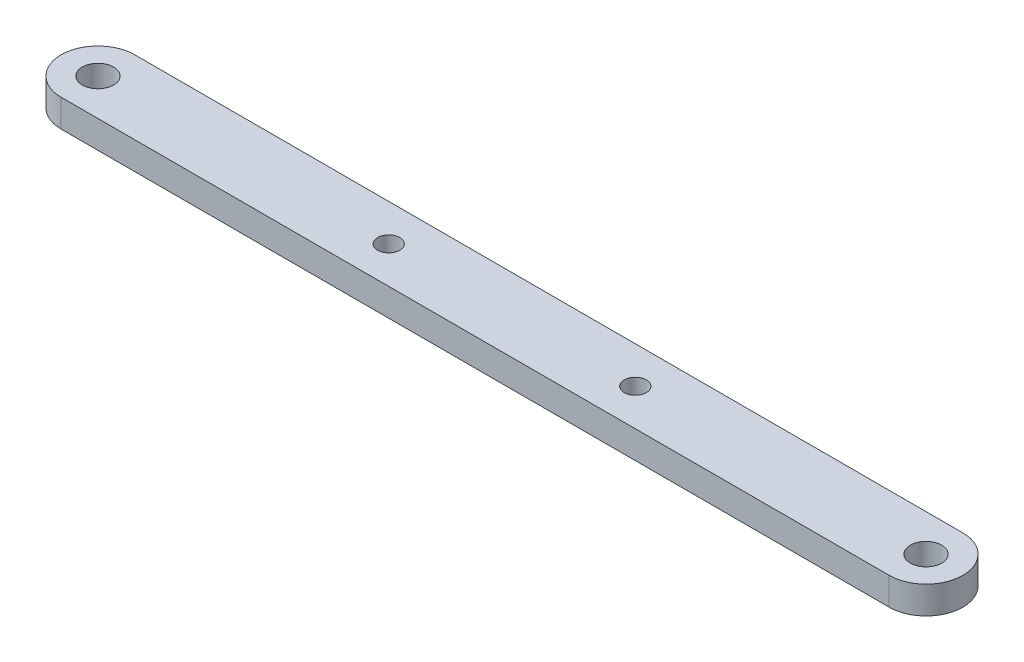
from build123d import *

# Parameters (mm, degrees)
BOSS_EXTRUDE1_DEPTH  = 3
M3_CLEARANCE_HOLE1_D = 3.4
M2_CLEARANCE_HOLE1_D = 2.4


with BuildPart() as part:
    # Sketch1 → Boss-Extrude1 (new body)
    with BuildSketch(Plane(origin=(0, 0, 0), x_dir=(1, 0, 0), z_dir=(0, 1, 0))):
        with BuildLine():
            Line((0, 4), (90, 4))
            ThreePointArc((90, 4), (94, 0), (90, -4))
            Line((90, -4), (0, -4))
            ThreePointArc((0, -4), (-4, 0), (0, 4))
        make_face()
    extrude(amount=BOSS_EXTRUDE1_DEPTH)

    # M3 Clearance Hole1 (through all)
    with Locations(Plane(origin=(0, 3, 0), x_dir=(1, 0, 0), z_dir=(0, 1, 0))):
        with Locations((90, 0), (0, 0)):
            Hole(M3_CLEARANCE_HOLE1_D / 2)

    # M2 Clearance Hole1 (through all)
    with Locations(Plane(origin=(0, 3, 0), x_dir=(1, 0, 0), z_dir=(0, 1, 0))):
        with Locations((58.4, 0), (31.6, 0)):
            Hole(M2_CLEARANCE_HOLE1_D / 2)


solid = part.part
